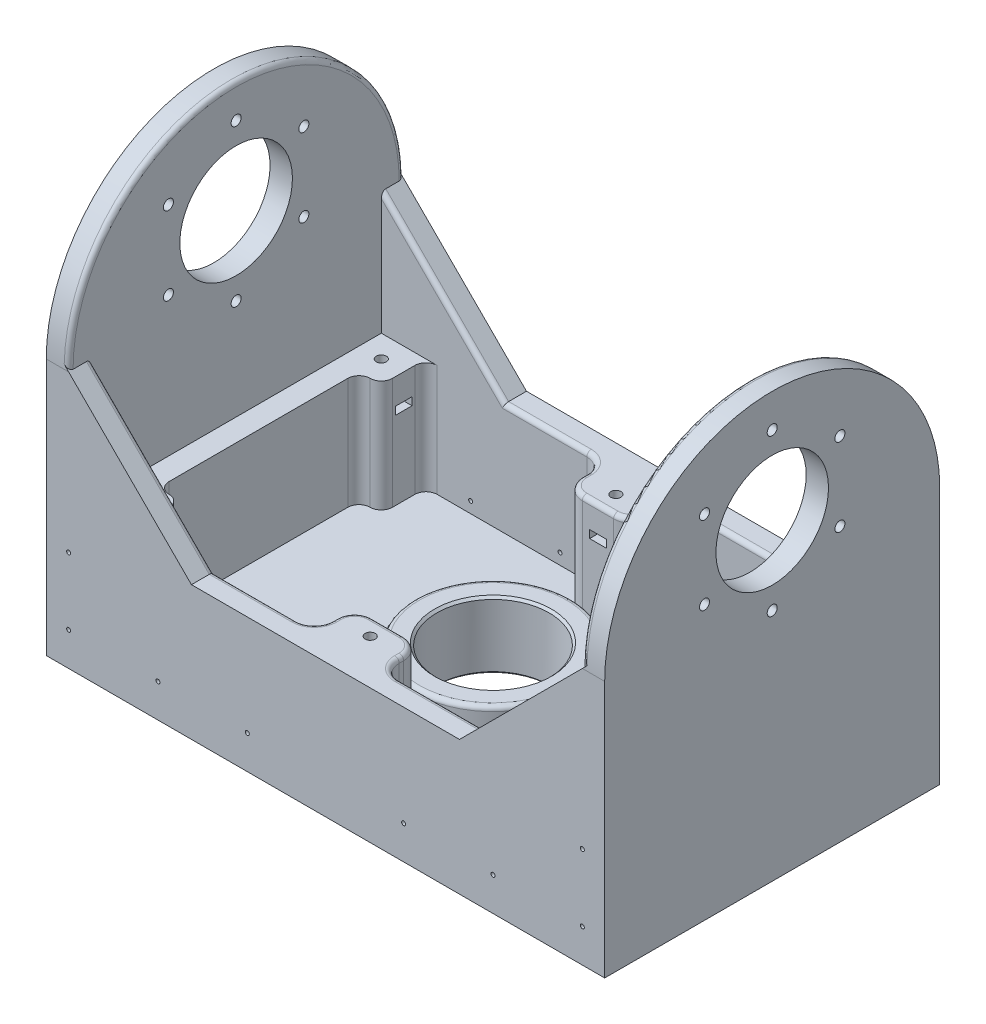
from build123d import *

# Parameters (mm, degrees)
SKETCH3_W               = 250
SKETCH3_H               = 150
BOSS_EXTRUDE1_DEPTH     = 10
SKETCH4_R               = 35
BOSS_EXTRUDE2_DEPTH     = 20
SKETCH5_R               = 25.15
CUT_EXTRUDE1_DEPTH      = 149.828760661
CHAMFER1_SIZE           = 1
FILLET1_R               = 2
FILLET2_R               = 10
BOSS_EXTRUDE3_DEPTH     = 10
SKETCH9_W               = 230
SKETCH9_H               = 150
SKETCH9_W_2             = 210
SKETCH9_H_2             = 130
BOSS_EXTRUDE4_DEPTH     = 50
BOSS_EXTRUDE5_DEPTH     = 10
SKETCH11_W              = 10
SKETCH11_H              = 20
BOSS_EXTRUDE7_DEPTH     = 50
SKETCH13_R              = 2.25
CUT_EXTRUDE2_DEPTH      = 25
CUT_EXTRUDE3_DEPTH      = 3.5
FILLET3_R               = 5
MIRROR3_COPY_1_DEPTH    = 10
MIRROR3_COPY_2_SKETCH_W = 10
MIRROR3_COPY_2_SKETCH_H = 20
MIRROR3_COPY_2_DEPTH    = 50
MIRROR3_COPY_3_SKETCH_R = 2.25
MIRROR3_COPY_3_DEPTH    = 25
MIRROR3_COPY_4_DEPTH    = 3.5
FILLET4_R               = 5
SKETCH15_W              = 30
SKETCH15_H              = 18
BOSS_EXTRUDE8_DEPTH     = 50
SKETCH17_R              = 2.25
CUT_EXTRUDE4_DEPTH      = 25
CUT_EXTRUDE5_DEPTH      = 3.5
FILLET5_R               = 8
FILLET6_R               = 8
CUT_EXTRUDE6_REACH      = 324.839
SKETCH19_R              = 25.2
CUT_EXTRUDE7_REACH      = 324.839
SKETCH20_R              = 2.25
CIRPATTERN1_COUNT       = 6
MIRROR5_COPY_1_REACH    = 324.839
MIRROR5_COPY_1_SKETCH_R = 2.25
MIRROR5_COPY_2_REACH    = 324.839
MIRROR5_COPY_2_SKETCH_R = 2.25
MIRROR5_COPY_3_REACH    = 324.839
MIRROR5_COPY_3_SKETCH_R = 2.25
MIRROR5_COPY_4_REACH    = 324.839
MIRROR5_COPY_4_SKETCH_R = 2.25
MIRROR5_COPY_5_REACH    = 324.839
MIRROR5_COPY_5_SKETCH_R = 2.25
CUT_EXTRUDE8_DEPTH      = 3.5
CIRPATTERN2_COUNT       = 6
FILLET7_R               = 2
SKETCH22_R              = 0.9
CUT_EXTRUDE10_DEPTH     = 10
MIRROR7_COPY_1_SKETCH_R = 0.9
MIRROR7_COPY_1_DEPTH    = 10


# Some blends are built 0.0001 mm under size
with BuildPart() as part:
    # Sketch3 → Boss-Extrude1 (new body)
    with BuildSketch(Plane(origin=(0, 0, 0), x_dir=(1, 0, 0), z_dir=(0, 1, 0))):
        Rectangle(SKETCH3_W, SKETCH3_H)
    extrude(amount=BOSS_EXTRUDE1_DEPTH)

    # Sketch4 → Boss-Extrude2 (add)
    with BuildSketch(Plane(origin=(0, 10, 0), x_dir=(1, 0, 0), z_dir=(0, 1, 0))):
        with Locations(Location((0, 0, 0), (0, 0, 270))):
            Circle(SKETCH4_R)
    extrude(amount=BOSS_EXTRUDE2_DEPTH)

    # Sketch5 → Cut-Extrude1 (cut, through all)
    with BuildSketch(Plane(origin=(0, 30, 0), x_dir=(1, 0, 0), z_dir=(0, 1, 0))):
        with Locations(Location((0, 0, 0), (0, 0, 270))):
            Circle(SKETCH5_R)
    extrude(amount=-CUT_EXTRUDE1_DEPTH, mode=Mode.SUBTRACT)

    # Chamfer1
    chamfer1_edges = [part.edges().sort_by_distance(p)[0] for p in [
        (0, 0, -25.15),
        (0, 30, -25.15),
    ]]
    chamfer(chamfer1_edges, length=CHAMFER1_SIZE)

    # Fillet1
    fillet1_edges = [part.edges().sort_by_distance(p)[0] for p in [
        (0, 30, -35),
    ]]
    fillet(fillet1_edges, radius=FILLET1_R)

    # Fillet2
    fillet2_edges = [part.edges().sort_by_distance(p)[0] for p in [
        (0, 10, -35),
    ]]
    fillet(fillet2_edges, radius=FILLET2_R)

    # Sketch8 → Boss-Extrude3 (add)
    with BuildSketch(Plane.ZY.offset(125)):
        with BuildLine():
            Line((-75, 10), (-75, 115))
            ThreePointArc((-75, 115), (0, 190), (75, 115))
            Line((75, 115), (75, 10))
            Line((75, 10), (-75, 10))
        make_face()
    boss_extrude3 = extrude(amount=-BOSS_EXTRUDE3_DEPTH)

    # Mirror1: Boss-Extrude3 across plane
    add(boss_extrude3.mirror(Plane(origin=(0, 0, 0), x_dir=(0, 0, 1), z_dir=(1, 0, 0))))

    # Sketch9 → Boss-Extrude4 (add)
    with BuildSketch(Plane(origin=(0, 10, 0), x_dir=(1, 0, 0), z_dir=(0, 1, 0))):
        Rectangle(SKETCH9_W, SKETCH9_H)
        Rectangle(SKETCH9_W_2, SKETCH9_H_2, mode=Mode.SUBTRACT)
    extrude(amount=BOSS_EXTRUDE4_DEPTH)

    # Sketch10 → Boss-Extrude5 (add)
    with BuildSketch(Plane.XY.offset(75)):
        Polygon((-115, 115), (-60, 60), (-115, 60), align=None)
    boss_extrude5 = extrude(amount=-BOSS_EXTRUDE5_DEPTH)

    # Sketch11 → Boss-Extrude7 (add)
    with BuildSketch(Plane(origin=(0, 10, 0), x_dir=(1, 0, 0), z_dir=(0, 1, 0))):
        with Locations((-100, -55)):
            Rectangle(SKETCH11_W, SKETCH11_H)
    boss_extrude7 = extrude(amount=BOSS_EXTRUDE7_DEPTH)

    # Sketch13 → Cut-Extrude2 (cut)
    with BuildSketch(Plane(origin=(0, 60, 0), x_dir=(1, 0, 0), z_dir=(0, 1, 0))):
        with Locations(Location((-105, -55, 0), (0, 0, 270))):
            Circle(SKETCH13_R)
    cut_extrude2 = extrude(amount=-CUT_EXTRUDE2_DEPTH, mode=Mode.SUBTRACT)

    # Sketch14 → Cut-Extrude3 (cut)
    with BuildSketch(Plane(origin=(0, 45, 0), x_dir=(1, 0, 0), z_dir=(0, 1, 0))):
        Polygon((-102.834936491, -51.25), (-95, -51.25), (-95, -58.75), (-102.834936491, -58.75), (-107.165063509, -58.75), (-109.330127019, -55), (-107.165063509, -51.25), align=None)
    cut_extrude3 = extrude(amount=CUT_EXTRUDE3_DEPTH, mode=Mode.SUBTRACT)

    # Fillet3
    fillet3_edges = [part.edges().sort_by_distance(p)[0] for p in [
        (-95, 35, 65),
        (-105, 35, 45),
        (-95, 35, 45),
    ]]
    fillet(fillet3_edges, radius=FILLET3_R - 0.0001)  # a hair under: the kernel refuses the full size

    # Mirror2: Boss-Extrude5, Boss-Extrude7, Cut-Extrude2, Cut-Extrude3 across plane
    add(boss_extrude5.mirror(Plane.XY))
    add(boss_extrude7.mirror(Plane.XY))
    add(cut_extrude2.mirror(Plane.XY), mode=Mode.SUBTRACT)
    add(cut_extrude3.mirror(Plane.XY), mode=Mode.SUBTRACT)

    # Mirror3: Boss-Extrude5, Boss-Extrude7, Cut-Extrude2, Cut-Extrude3 across plane
    add(boss_extrude5.mirror(Plane(origin=(0, 0, 0), x_dir=(0, 0, 1), z_dir=(1, 0, 0))))
    add(boss_extrude7.mirror(Plane(origin=(0, 0, 0), x_dir=(0, 0, 1), z_dir=(1, 0, 0))))
    add(cut_extrude2.mirror(Plane(origin=(0, 0, 0), x_dir=(0, 0, 1), z_dir=(1, 0, 0))), mode=Mode.SUBTRACT)
    add(cut_extrude3.mirror(Plane(origin=(0, 0, 0), x_dir=(0, 0, 1), z_dir=(1, 0, 0))), mode=Mode.SUBTRACT)

    # Mirror3 copy 1 sketch → Mirror3 copy 1 (add)
    with BuildSketch(Plane(origin=(0, 0, -75), x_dir=(-1, 0, 0), z_dir=(0, 0, -1))):
        Polygon((-115, 115), (-60, 60), (-115, 60), align=None)
    extrude(amount=-MIRROR3_COPY_1_DEPTH)

    # Mirror3 copy 2 sketch → Mirror3 copy 2 (add)
    with BuildSketch(Plane(origin=(0, 10, 0), x_dir=(-1, 0, 0), z_dir=(0, 1, 0))):
        with Locations((-100, -55)):
            Rectangle(MIRROR3_COPY_2_SKETCH_W, MIRROR3_COPY_2_SKETCH_H)
    extrude(amount=MIRROR3_COPY_2_DEPTH)

    # Mirror3 copy 3 sketch → Mirror3 copy 3 (cut)
    with BuildSketch(Plane(origin=(0, 60, 0), x_dir=(-1, 0, 0), z_dir=(0, 1, 0))):
        with Locations(Location((-105, -55, 0), (0, 0, 270))):
            Circle(MIRROR3_COPY_3_SKETCH_R)
    extrude(amount=-MIRROR3_COPY_3_DEPTH, mode=Mode.SUBTRACT)

    # Mirror3 copy 4 sketch → Mirror3 copy 4 (cut)
    with BuildSketch(Plane(origin=(0, 45, 0), x_dir=(-1, 0, 0), z_dir=(0, 1, 0))):
        Polygon((-102.834936491, -51.25), (-95, -51.25), (-95, -58.75), (-102.834936491, -58.75), (-107.165063509, -58.75), (-109.330127019, -55), (-107.165063509, -51.25), align=None)
    extrude(amount=MIRROR3_COPY_4_DEPTH, mode=Mode.SUBTRACT)

    # Fillet4
    fillet4_edges = [part.edges().sort_by_distance(p)[0] for p in [
        (-95, 35, -65),
        (-95, 35, -45),
        (-105, 35, -45),
        (105, 35, -45),
        (95, 35, -65),
        (95, 35, -45),
        (95, 35, 65),
        (95, 35, 45),
        (105, 35, 45),
    ]]
    fillet(fillet4_edges, radius=FILLET4_R - 0.0001)  # a hair under: the kernel refuses the full size

    # Sketch15 → Boss-Extrude8 (add)
    with BuildSketch(Plane(origin=(0, 10, 0), x_dir=(1, 0, 0), z_dir=(0, 1, 0))):
        with Locations((0, -56)):
            Rectangle(SKETCH15_W, SKETCH15_H)
    boss_extrude8 = extrude(amount=BOSS_EXTRUDE8_DEPTH)

    # Sketch17 → Cut-Extrude4 (cut)
    with BuildSketch(Plane(origin=(0, 60, 0), x_dir=(1, 0, 0), z_dir=(0, 1, 0))):
        with Locations(Location((0, -55, 0), (0, 0, 270))):
            Circle(SKETCH17_R)
    cut_extrude4 = extrude(amount=-CUT_EXTRUDE4_DEPTH, mode=Mode.SUBTRACT)

    # Sketch18 → Cut-Extrude5 (cut)
    with BuildSketch(Plane(origin=(0, 45, 0), x_dir=(1, 0, 0), z_dir=(0, 1, 0))):
        Polygon((-3.75, -52.834936491), (-3.75, -47), (3.75, -47), (3.75, -52.834936491), (3.75, -57.165063509), (0, -59.330127019), (-3.75, -57.165063509), align=None)
    cut_extrude5 = extrude(amount=CUT_EXTRUDE5_DEPTH, mode=Mode.SUBTRACT)

    # Fillet5
    fillet5_edges = [part.edges().sort_by_distance(p)[0] for p in [
        (-15, 35, 65),
        (15, 35, 65),
        (15, 35, 47),
        (-15, 35, 47),
    ]]
    fillet(fillet5_edges, radius=FILLET5_R)

    # Mirror4: Boss-Extrude8, Cut-Extrude4, Cut-Extrude5 across plane
    add(boss_extrude8.mirror(Plane.XY))
    add(cut_extrude4.mirror(Plane.XY), mode=Mode.SUBTRACT)
    add(cut_extrude5.mirror(Plane.XY), mode=Mode.SUBTRACT)

    # Fillet6
    fillet6_edges = [part.edges().sort_by_distance(p)[0] for p in [
        (15, 35, -47),
        (-15, 35, -47),
        (-15, 35, -65),
        (15, 35, -65),
    ]]
    fillet(fillet6_edges, radius=FILLET6_R)

    # Sketch19 → Cut-Extrude6 (cut, up to next)
    with BuildSketch(Plane(origin=(125, 0, 0), x_dir=(0, 0, -1), z_dir=(1, 0, 0)), mode=Mode.PRIVATE) as cut_extrude6_sk1:
        with Locations((0, 140)):
            Circle(SKETCH19_R)
    cut_extrude6_tool1 = extrude(cut_extrude6_sk1.sketch, amount=-CUT_EXTRUDE6_REACH, mode=Mode.PRIVATE) & part.part
    cut_extrude6 = cut_extrude6_tool1.solids().sort_by_distance((125, 140, 0))[0]
    add(cut_extrude6, mode=Mode.SUBTRACT)

    # Sketch20 → Cut-Extrude7 (cut, up to next)
    with BuildSketch(Plane(origin=(125, 0, 0), x_dir=(0, 0, -1), z_dir=(1, 0, 0)), mode=Mode.PRIVATE) as cut_extrude7_sk1:
        with Locations((0, 105)):
            Circle(SKETCH20_R)
    cut_extrude7_tool1 = extrude(cut_extrude7_sk1.sketch, amount=-CUT_EXTRUDE7_REACH, mode=Mode.PRIVATE) & part.part
    cut_extrude7 = cut_extrude7_tool1.solids().sort_by_distance((125, 105, 0))[0]
    add(cut_extrude7, mode=Mode.SUBTRACT)

    # CirPattern1: Cut-Extrude7 ×6 about axis
    cirpattern1_axis = Axis((0, 140, 0), (1, 0, 0))
    for i in range(1, CIRPATTERN1_COUNT):
        add(cut_extrude7.rotate(cirpattern1_axis, i * 360 / CIRPATTERN1_COUNT), mode=Mode.SUBTRACT)

    # Mirror5: Cut-Extrude6, Cut-Extrude7 across plane
    add(cut_extrude6.mirror(Plane(origin=(0, 0, 0), x_dir=(0, 0, 1), z_dir=(1, 0, 0))), mode=Mode.SUBTRACT)
    add(cut_extrude7.mirror(Plane(origin=(0, 0, 0), x_dir=(0, 0, 1), z_dir=(1, 0, 0))), mode=Mode.SUBTRACT)

    # Mirror5 copy 1 sketch → Mirror5 copy 1 (cut, up to next)
    with BuildSketch(Plane(origin=(-125, 70, -121.24355653), x_dir=(0, 0.8660254037844386, -0.5000000000000001), z_dir=(-1, 0, 0)), mode=Mode.PRIVATE) as mirror5_copy_1_sk1:
        with Locations((0, -105)):
            Circle(MIRROR5_COPY_1_SKETCH_R)
    mirror5_copy_1_tool1 = extrude(mirror5_copy_1_sk1.sketch, amount=-MIRROR5_COPY_1_REACH, mode=Mode.PRIVATE) & part.part
    add(mirror5_copy_1_tool1.solids().sort_by_distance((-125, 122.5, -30.310889132))[0], mode=Mode.SUBTRACT)

    # Mirror5 copy 2 sketch → Mirror5 copy 2 (cut, up to next)
    with BuildSketch(Plane(origin=(-125, 210, -121.24355653), x_dir=(0, 0.8660254037844387, 0.4999999999999998), z_dir=(-1, 0, 0)), mode=Mode.PRIVATE) as mirror5_copy_2_sk1:
        with Locations((0, -105)):
            Circle(MIRROR5_COPY_2_SKETCH_R)
    mirror5_copy_2_tool1 = extrude(mirror5_copy_2_sk1.sketch, amount=-MIRROR5_COPY_2_REACH, mode=Mode.PRIVATE) & part.part
    add(mirror5_copy_2_tool1.solids().sort_by_distance((-125, 157.5, -30.310889132))[0], mode=Mode.SUBTRACT)

    # Mirror5 copy 3 sketch → Mirror5 copy 3 (cut, up to next)
    with BuildSketch(Plane(origin=(-125, 280, 0), x_dir=(0, 0, 1), z_dir=(-1, 0, 0)), mode=Mode.PRIVATE) as mirror5_copy_3_sk1:
        with Locations((0, -105)):
            Circle(MIRROR5_COPY_3_SKETCH_R)
    mirror5_copy_3_tool1 = extrude(mirror5_copy_3_sk1.sketch, amount=-MIRROR5_COPY_3_REACH, mode=Mode.PRIVATE) & part.part
    add(mirror5_copy_3_tool1.solids().sort_by_distance((-125, 175, 0))[0], mode=Mode.SUBTRACT)

    # Mirror5 copy 4 sketch → Mirror5 copy 4 (cut, up to next)
    with BuildSketch(Plane(origin=(-125, 210, 121.24355653), x_dir=(0, -0.8660254037844384, 0.5000000000000004), z_dir=(-1, 0, 0)), mode=Mode.PRIVATE) as mirror5_copy_4_sk1:
        with Locations((0, -105)):
            Circle(MIRROR5_COPY_4_SKETCH_R)
    mirror5_copy_4_tool1 = extrude(mirror5_copy_4_sk1.sketch, amount=-MIRROR5_COPY_4_REACH, mode=Mode.PRIVATE) & part.part
    add(mirror5_copy_4_tool1.solids().sort_by_distance((-125, 157.5, 30.310889132))[0], mode=Mode.SUBTRACT)

    # Mirror5 copy 5 sketch → Mirror5 copy 5 (cut, up to next)
    with BuildSketch(Plane(origin=(-125, 70, 121.24355653), x_dir=(0, -0.8660254037844386, -0.5000000000000001), z_dir=(-1, 0, 0)), mode=Mode.PRIVATE) as mirror5_copy_5_sk1:
        with Locations((0, -105)):
            Circle(MIRROR5_COPY_5_SKETCH_R)
    mirror5_copy_5_tool1 = extrude(mirror5_copy_5_sk1.sketch, amount=-MIRROR5_COPY_5_REACH, mode=Mode.PRIVATE) & part.part
    add(mirror5_copy_5_tool1.solids().sort_by_distance((-125, 122.5, 30.310889132))[0], mode=Mode.SUBTRACT)

    # Sketch21 → Cut-Extrude8 (cut)
    with BuildSketch(Plane.ZY.offset(-115)):
        Polygon((0, 170.669872981), (3.75, 172.834936491), (3.75, 177.165063509), (0, 179.330127019), (-3.75, 177.165063509), (-3.75, 172.834936491), align=None)
    cut_extrude8 = extrude(amount=-CUT_EXTRUDE8_DEPTH, mode=Mode.SUBTRACT)

    # CirPattern2: Cut-Extrude8 ×6 about axis
    cirpattern2_axis = Axis((0, 140, 0), (1, 0, 0))
    for i in range(1, CIRPATTERN2_COUNT):
        add(cut_extrude8.rotate(cirpattern2_axis, i * 360 / CIRPATTERN2_COUNT), mode=Mode.SUBTRACT)

    # Fillet7
    # the kernel refuses this fillet: 2 mm, written as the material it takes off along each edge
    with BuildSketch(Plane(origin=(-65, 60, 65), x_dir=(0, -1, 0), z_dir=(1, 0, 0))) as fillet7_piece_1_section:
        with BuildLine():
            CenterArc((FILLET7_R, -FILLET7_R), FILLET7_R, 90, 90)
            Line((0, -FILLET7_R), (0, 0))
            Line((0, 0), (FILLET7_R, 0))
        make_face()
    fillet7_piece_1 = extrude(amount=42, mode=Mode.PRIVATE)
    fillet7_piece_1 = split(fillet7_piece_1, bisect_by=Plane(origin=(-50.414222392, 50.414222392, 65.455795296), z_dir=(0.7071067811865389, 0.7071067811865562, 0)), keep=Keep.TOP, mode=Mode.PRIVATE)
    add(fillet7_piece_1, mode=Mode.SUBTRACT)
    with BuildSketch(Plane(origin=(-118.535533906, 118.535533906, 65), x_dir=(-0.7071067811865389, -0.7071067811865562, 0), z_dir=(0.7071067811865562, -0.7071067811865389, 0))) as fillet7_piece_2_section:
        with BuildLine():
            CenterArc((FILLET7_R, -FILLET7_R), FILLET7_R, 90, 90)
            Line((0, -FILLET7_R), (0, 0))
            Line((0, 0), (FILLET7_R, 0))
        make_face()
    fillet7_piece_2 = extrude(amount=87.781745931, mode=Mode.PRIVATE)
    fillet7_piece_2 = split(fillet7_piece_2, bisect_by=Plane(origin=(-115, 87.183248895, 65.455647469), z_dir=(1, 0, 0)), keep=Keep.TOP, mode=Mode.PRIVATE)
    fillet7_piece_2 = split(fillet7_piece_2, bisect_by=Plane(origin=(-87.816751105, 60, 65.455647469), z_dir=(0, 1, 0)), keep=Keep.TOP, mode=Mode.PRIVATE)
    add(fillet7_piece_2, mode=Mode.SUBTRACT)
    with BuildSketch(Plane(origin=(-118.535533906, 118.535533906, -65), x_dir=(-0.7071067811865389, -0.7071067811865562, 0), z_dir=(0.7071067811865562, -0.7071067811865389, 0))) as fillet7_piece_3_section:
        with BuildLine():
            CenterArc((FILLET7_R, FILLET7_R), FILLET7_R, 180, 90)
            Line((0, FILLET7_R), (0, 0))
            Line((0, 0), (FILLET7_R, 0))
        make_face()
    fillet7_piece_3 = extrude(amount=87.781745931, mode=Mode.PRIVATE)
    fillet7_piece_3 = split(fillet7_piece_3, bisect_by=Plane(origin=(-115, 87.183248895, -65.455647469), z_dir=(1, 0, 0)), keep=Keep.TOP, mode=Mode.PRIVATE)
    fillet7_piece_3 = split(fillet7_piece_3, bisect_by=Plane(origin=(-87.816751105, 60, -65.455647469), z_dir=(0, 1, 0)), keep=Keep.TOP, mode=Mode.PRIVATE)
    add(fillet7_piece_3, mode=Mode.SUBTRACT)
    with BuildSketch(Plane(origin=(65, 60, -65), x_dir=(0, -1, 0), z_dir=(-1, 0, 0))) as fillet7_piece_4_section:
        with BuildLine():
            CenterArc((FILLET7_R, -FILLET7_R), FILLET7_R, 90, 90)
            Line((0, -FILLET7_R), (0, 0))
            Line((0, 0), (FILLET7_R, 0))
        make_face()
    fillet7_piece_4 = extrude(amount=42, mode=Mode.PRIVATE)
    fillet7_piece_4 = split(fillet7_piece_4, bisect_by=Plane(origin=(50.414222392, 50.414222392, -65.455795296), z_dir=(-0.7071067811865389, 0.7071067811865562, 0)), keep=Keep.TOP, mode=Mode.PRIVATE)
    add(fillet7_piece_4, mode=Mode.SUBTRACT)
    with BuildSketch(Plane(origin=(118.535533906, 118.535533906, -65), x_dir=(0.7071067811865389, -0.7071067811865562, 0), z_dir=(-0.7071067811865562, -0.7071067811865389, 0))) as fillet7_piece_5_section:
        with BuildLine():
            CenterArc((FILLET7_R, -FILLET7_R), FILLET7_R, 90, 90)
            Line((0, -FILLET7_R), (0, 0))
            Line((0, 0), (FILLET7_R, 0))
        make_face()
    fillet7_piece_5 = extrude(amount=87.781745931, mode=Mode.PRIVATE)
    fillet7_piece_5 = split(fillet7_piece_5, bisect_by=Plane(origin=(115, 87.183248895, -65.455647469), z_dir=(-1, 0, 0)), keep=Keep.TOP, mode=Mode.PRIVATE)
    fillet7_piece_5 = split(fillet7_piece_5, bisect_by=Plane(origin=(87.816751105, 60, -65.455647469), z_dir=(0, 1, 0)), keep=Keep.TOP, mode=Mode.PRIVATE)
    add(fillet7_piece_5, mode=Mode.SUBTRACT)
    with BuildSketch(Plane(origin=(118.535533906, 118.535533906, 65), x_dir=(0.7071067811865389, -0.7071067811865562, 0), z_dir=(-0.7071067811865562, -0.7071067811865389, 0))) as fillet7_piece_6_section:
        with BuildLine():
            CenterArc((FILLET7_R, FILLET7_R), FILLET7_R, 180, 90)
            Line((0, FILLET7_R), (0, 0))
            Line((0, 0), (FILLET7_R, 0))
        make_face()
    fillet7_piece_6 = extrude(amount=87.781745931, mode=Mode.PRIVATE)
    fillet7_piece_6 = split(fillet7_piece_6, bisect_by=Plane(origin=(115, 87.183248895, 65.455647469), z_dir=(-1, 0, 0)), keep=Keep.TOP, mode=Mode.PRIVATE)
    fillet7_piece_6 = split(fillet7_piece_6, bisect_by=Plane(origin=(87.816751105, 60, 65.455647469), z_dir=(0, 1, 0)), keep=Keep.TOP, mode=Mode.PRIVATE)
    add(fillet7_piece_6, mode=Mode.SUBTRACT)
    with BuildSketch(Plane(origin=(-15, 60, 57), x_dir=(0, -1, 0), z_dir=(0, 0, -1)), Plane(origin=(15, 60, 55), x_dir=(0, -1, 0), z_dir=(0, 0, 1))) as fillet7_piece_7:
        with BuildLine():
            CenterArc((FILLET7_R, -FILLET7_R), FILLET7_R, 90, 90)
            Line((0, -FILLET7_R), (0, 0))
            Line((0, 0), (FILLET7_R, 0))
        make_face()
    extrude(amount=2, mode=Mode.SUBTRACT)
    with BuildSketch(Plane(origin=(23, 60, 65), x_dir=(0, -1, 0), z_dir=(1, 0, 0))) as fillet7_piece_8_section:
        with BuildLine():
            CenterArc((FILLET7_R, -FILLET7_R), FILLET7_R, 90, 90)
            Line((0, -FILLET7_R), (0, 0))
            Line((0, 0), (FILLET7_R, 0))
        make_face()
    fillet7_piece_8 = extrude(amount=42, mode=Mode.PRIVATE)
    fillet7_piece_8 = split(fillet7_piece_8, bisect_by=Plane(origin=(50.414222392, 50.414222392, 65.455795296), z_dir=(-0.7071067811865389, 0.7071067811865562, 0)), keep=Keep.TOP, mode=Mode.PRIVATE)
    add(fillet7_piece_8, mode=Mode.SUBTRACT)
    with BuildSketch(Plane(origin=(-7, 60, 47), x_dir=(0, -1, 0), z_dir=(1, 0, 0))) as fillet7_piece_9:
        with BuildLine():
            CenterArc((FILLET7_R, -FILLET7_R), FILLET7_R, 90, 90)
            Line((0, -FILLET7_R), (0, 0))
            Line((0, 0), (FILLET7_R, 0))
        make_face()
    extrude(amount=14, mode=Mode.SUBTRACT)
    with BuildSketch(Plane(origin=(-7, 60, 55), x_dir=(0, 0, -1), z_dir=(1, 0, 0))) as fillet7_piece_10:
        with BuildLine():
            CenterArc((8 - FILLET7_R, -FILLET7_R), FILLET7_R, 0, 90)
            Line((8 - FILLET7_R, 0), (8, 0))
            Line((8, 0), (8, -FILLET7_R))
        make_face()
    revolve(axis=Axis((-7, 60, 55), (0, 1, 0)), revolution_arc=90, mode=Mode.SUBTRACT)
    with BuildSketch(Plane(origin=(7, 60, 55), x_dir=(1, 0, 0), z_dir=(0, 0, 1))) as fillet7_piece_11:
        with BuildLine():
            CenterArc((8 - FILLET7_R, -FILLET7_R), FILLET7_R, 0, 90)
            Line((8 - FILLET7_R, 0), (8, 0))
            Line((8, 0), (8, -FILLET7_R))
        make_face()
    revolve(axis=Axis((7, 60, 55), (0, 1, 0)), revolution_arc=90, mode=Mode.SUBTRACT)
    with BuildSketch(Plane(origin=(-23, 60, 57), x_dir=(1, 0, 0), z_dir=(0, 0, -1))) as fillet7_piece_12:
        with BuildLine():
            CenterArc((8 + FILLET7_R, FILLET7_R), FILLET7_R, 180, 90)
            Line((8 + FILLET7_R, 0), (8, 0))
            Line((8, 0), (8, FILLET7_R))
        make_face()
    revolve(axis=Axis((-23, 60, 57), (0, -1, 0)), revolution_arc=90, mode=Mode.SUBTRACT)
    with BuildSketch(Plane(origin=(23, 60, 57), x_dir=(0, 0, 1), z_dir=(1, 0, 0))) as fillet7_piece_13:
        with BuildLine():
            CenterArc((8 + FILLET7_R, FILLET7_R), FILLET7_R, 180, 90)
            Line((8 + FILLET7_R, 0), (8, 0))
            Line((8, 0), (8, FILLET7_R))
        make_face()
    revolve(axis=Axis((23, 60, 57), (0, -1, 0)), revolution_arc=90, mode=Mode.SUBTRACT)
    with BuildSketch(Plane(origin=(15, 60, -55), x_dir=(0, -1, 0), z_dir=(0, 0, -1)), Plane(origin=(-15, 60, -57), x_dir=(0, -1, 0), z_dir=(0, 0, 1))) as fillet7_piece_14:
        with BuildLine():
            CenterArc((FILLET7_R, FILLET7_R), FILLET7_R, 180, 90)
            Line((0, FILLET7_R), (0, 0))
            Line((0, 0), (FILLET7_R, 0))
        make_face()
    extrude(amount=2, mode=Mode.SUBTRACT)
    with BuildSketch(Plane(origin=(-7, 60, -47), x_dir=(0, -1, 0), z_dir=(1, 0, 0))) as fillet7_piece_15:
        with BuildLine():
            CenterArc((FILLET7_R, FILLET7_R), FILLET7_R, 180, 90)
            Line((0, FILLET7_R), (0, 0))
            Line((0, 0), (FILLET7_R, 0))
        make_face()
    extrude(amount=14, mode=Mode.SUBTRACT)
    with BuildSketch(Plane(origin=(-115, 115, 0), x_dir=(0, -0.06672426898391166, -0.997771452752865), z_dir=(0, -0.997771452752865, 0.06672426898391166))) as fillet7_piece_16_section:
        with BuildLine():
            CenterArc((75 - FILLET7_R, -FILLET7_R), FILLET7_R, 0, 90)
            Line((75, -FILLET7_R), (75, 0))
            Line((75, 0), (75 - FILLET7_R, 0))
        make_face()
    fillet7_piece_16 = revolve(axis=Axis((-115, 115, 0), (1, 0, 0)), revolution_arc=187.651722928, mode=Mode.PRIVATE)
    fillet7_piece_16 = split(fillet7_piece_16, bisect_by=Plane(origin=(-152.5, 152.5, 0), z_dir=(0.7071067811865389, 0.7071067811865562, 0)), keep=Keep.TOP, mode=Mode.PRIVATE)
    add(fillet7_piece_16, mode=Mode.SUBTRACT)
    with BuildSketch(Plane(origin=(-23, 60, -65), x_dir=(0, -1, 0), z_dir=(-1, 0, 0))) as fillet7_piece_17_section:
        with BuildLine():
            CenterArc((FILLET7_R, -FILLET7_R), FILLET7_R, 90, 90)
            Line((0, -FILLET7_R), (0, 0))
            Line((0, 0), (FILLET7_R, 0))
        make_face()
    fillet7_piece_17 = extrude(amount=42, mode=Mode.PRIVATE)
    fillet7_piece_17 = split(fillet7_piece_17, bisect_by=Plane(origin=(-50.414222392, 50.414222392, -65.455795296), z_dir=(0.7071067811865389, 0.7071067811865562, 0)), keep=Keep.TOP, mode=Mode.PRIVATE)
    add(fillet7_piece_17, mode=Mode.SUBTRACT)
    with BuildSketch(Plane(origin=(-7, 60, -55), x_dir=(-1, 0, 0), z_dir=(0, 0, -1))) as fillet7_piece_18:
        with BuildLine():
            CenterArc((8 - FILLET7_R, -FILLET7_R), FILLET7_R, 0, 90)
            Line((8 - FILLET7_R, 0), (8, 0))
            Line((8, 0), (8, -FILLET7_R))
        make_face()
    revolve(axis=Axis((-7, 60, -55), (0, 1, 0)), revolution_arc=90, mode=Mode.SUBTRACT)
    with BuildSketch(Plane(origin=(7, 60, -55), x_dir=(0, 0, 1), z_dir=(-1, 0, 0))) as fillet7_piece_19:
        with BuildLine():
            CenterArc((8 - FILLET7_R, -FILLET7_R), FILLET7_R, 0, 90)
            Line((8 - FILLET7_R, 0), (8, 0))
            Line((8, 0), (8, -FILLET7_R))
        make_face()
    revolve(axis=Axis((7, 60, -55), (0, 1, 0)), revolution_arc=90, mode=Mode.SUBTRACT)
    with BuildSketch(Plane(origin=(23, 60, -57), x_dir=(-1, 0, 0), z_dir=(0, 0, 1))) as fillet7_piece_20:
        with BuildLine():
            CenterArc((8 + FILLET7_R, FILLET7_R), FILLET7_R, 180, 90)
            Line((8 + FILLET7_R, 0), (8, 0))
            Line((8, 0), (8, FILLET7_R))
        make_face()
    revolve(axis=Axis((23, 60, -57), (0, -1, 0)), revolution_arc=90, mode=Mode.SUBTRACT)
    with BuildSketch(Plane(origin=(-23, 60, -57), x_dir=(0, 0, -1), z_dir=(-1, 0, 0))) as fillet7_piece_21:
        with BuildLine():
            CenterArc((8 + FILLET7_R, FILLET7_R), FILLET7_R, 180, 90)
            Line((8 + FILLET7_R, 0), (8, 0))
            Line((8, 0), (8, FILLET7_R))
        make_face()
    revolve(axis=Axis((-23, 60, -57), (0, -1, 0)), revolution_arc=90, mode=Mode.SUBTRACT)
    with BuildSketch(Plane(origin=(115, 115, 0), x_dir=(0, -0.06672426898391166, -0.997771452752865), z_dir=(0, -0.997771452752865, 0.06672426898391166))) as fillet7_piece_22_section:
        with BuildLine():
            CenterArc((75 - FILLET7_R, FILLET7_R), FILLET7_R, 270, 90)
            Line((75, FILLET7_R), (75, 0))
            Line((75, 0), (75 - FILLET7_R, 0))
        make_face()
    fillet7_piece_22 = revolve(axis=Axis((115, 115, 0), (1, 0, 0)), revolution_arc=187.651722928, mode=Mode.PRIVATE)
    fillet7_piece_22 = split(fillet7_piece_22, bisect_by=Plane(origin=(152.5, 152.5, 0), z_dir=(-0.7071067811865389, 0.7071067811865562, 0)), keep=Keep.TOP, mode=Mode.PRIVATE)
    add(fillet7_piece_22, mode=Mode.SUBTRACT)
    with BuildSketch(Plane(origin=(-65, 60, 65), x_dir=(0, -1, 0), z_dir=(1, 0, 0))) as fillet7_piece_23a_section:
        with BuildLine():
            CenterArc((FILLET7_R, -FILLET7_R), FILLET7_R, 90, 90)
            Line((0, -FILLET7_R), (0, 0))
            Line((0, 0), (FILLET7_R, 0))
        make_face()
    fillet7_piece_23a = extrude(amount=42, mode=Mode.PRIVATE)
    fillet7_piece_23a = split(fillet7_piece_23a, bisect_by=Plane(origin=(-60.88483695, 60.88483695, 65.432648826), z_dir=(-0.7071067811865389, -0.7071067811865562, 0)), keep=Keep.TOP, mode=Mode.PRIVATE)
    with BuildSketch(Plane(origin=(-118.535533906, 118.535533906, 65), x_dir=(-0.7071067811865389, -0.7071067811865562, 0), z_dir=(0.7071067811865562, -0.7071067811865389, 0))) as fillet7_piece_23b_section:
        with BuildLine():
            CenterArc((FILLET7_R, -FILLET7_R), FILLET7_R, 90, 90)
            Line((0, -FILLET7_R), (0, 0))
            Line((0, 0), (FILLET7_R, 0))
        make_face()
    fillet7_piece_23b = extrude(amount=87.781745931, mode=Mode.PRIVATE)
    fillet7_piece_23b = split(fillet7_piece_23b, bisect_by=Plane(origin=(-58.748651584, 60, 65.432648826), z_dir=(0, -1, 0)), keep=Keep.TOP, mode=Mode.PRIVATE)
    fillet7_piece_23 = fillet7_piece_23a & fillet7_piece_23b
    add(fillet7_piece_23, mode=Mode.SUBTRACT)
    with BuildSketch(Plane(origin=(-23, 60, -65), x_dir=(0, -1, 0), z_dir=(-1, 0, 0))) as fillet7_piece_24a_section:
        with BuildLine():
            CenterArc((FILLET7_R, -FILLET7_R), FILLET7_R, 90, 90)
            Line((0, -FILLET7_R), (0, 0))
            Line((0, 0), (FILLET7_R, 0))
        make_face()
    fillet7_piece_24a = extrude(amount=42, mode=Mode.PRIVATE)
    fillet7_piece_24a = split(fillet7_piece_24a, bisect_by=Plane(origin=(-60.88483695, 60.88483695, -65.432648826), z_dir=(-0.7071067811865389, -0.7071067811865562, 0)), keep=Keep.TOP, mode=Mode.PRIVATE)
    with BuildSketch(Plane(origin=(-118.535533906, 118.535533906, -65), x_dir=(-0.7071067811865389, -0.7071067811865562, 0), z_dir=(0.7071067811865562, -0.7071067811865389, 0))) as fillet7_piece_24b_section:
        with BuildLine():
            CenterArc((FILLET7_R, FILLET7_R), FILLET7_R, 180, 90)
            Line((0, FILLET7_R), (0, 0))
            Line((0, 0), (FILLET7_R, 0))
        make_face()
    fillet7_piece_24b = extrude(amount=87.781745931, mode=Mode.PRIVATE)
    fillet7_piece_24b = split(fillet7_piece_24b, bisect_by=Plane(origin=(-58.748651584, 60, -65.432648826), z_dir=(0, -1, 0)), keep=Keep.TOP, mode=Mode.PRIVATE)
    fillet7_piece_24 = fillet7_piece_24a & fillet7_piece_24b
    add(fillet7_piece_24, mode=Mode.SUBTRACT)
    with BuildSketch(Plane(origin=(65, 60, -65), x_dir=(0, -1, 0), z_dir=(-1, 0, 0))) as fillet7_piece_25a_section:
        with BuildLine():
            CenterArc((FILLET7_R, -FILLET7_R), FILLET7_R, 90, 90)
            Line((0, -FILLET7_R), (0, 0))
            Line((0, 0), (FILLET7_R, 0))
        make_face()
    fillet7_piece_25a = extrude(amount=42, mode=Mode.PRIVATE)
    fillet7_piece_25a = split(fillet7_piece_25a, bisect_by=Plane(origin=(60.88483695, 60.88483695, -65.432648826), z_dir=(0.7071067811865389, -0.7071067811865562, 0)), keep=Keep.TOP, mode=Mode.PRIVATE)
    with BuildSketch(Plane(origin=(118.535533906, 118.535533906, -65), x_dir=(0.7071067811865389, -0.7071067811865562, 0), z_dir=(-0.7071067811865562, -0.7071067811865389, 0))) as fillet7_piece_25b_section:
        with BuildLine():
            CenterArc((FILLET7_R, -FILLET7_R), FILLET7_R, 90, 90)
            Line((0, -FILLET7_R), (0, 0))
            Line((0, 0), (FILLET7_R, 0))
        make_face()
    fillet7_piece_25b = extrude(amount=87.781745931, mode=Mode.PRIVATE)
    fillet7_piece_25b = split(fillet7_piece_25b, bisect_by=Plane(origin=(58.748651584, 60, -65.432648826), z_dir=(0, -1, 0)), keep=Keep.TOP, mode=Mode.PRIVATE)
    fillet7_piece_25 = fillet7_piece_25a & fillet7_piece_25b
    add(fillet7_piece_25, mode=Mode.SUBTRACT)
    with BuildSketch(Plane(origin=(23, 60, 65), x_dir=(0, -1, 0), z_dir=(1, 0, 0))) as fillet7_piece_26a_section:
        with BuildLine():
            CenterArc((FILLET7_R, -FILLET7_R), FILLET7_R, 90, 90)
            Line((0, -FILLET7_R), (0, 0))
            Line((0, 0), (FILLET7_R, 0))
        make_face()
    fillet7_piece_26a = extrude(amount=42, mode=Mode.PRIVATE)
    fillet7_piece_26a = split(fillet7_piece_26a, bisect_by=Plane(origin=(60.88483695, 60.88483695, 65.432648826), z_dir=(0.7071067811865389, -0.7071067811865562, 0)), keep=Keep.TOP, mode=Mode.PRIVATE)
    with BuildSketch(Plane(origin=(118.535533906, 118.535533906, 65), x_dir=(0.7071067811865389, -0.7071067811865562, 0), z_dir=(-0.7071067811865562, -0.7071067811865389, 0))) as fillet7_piece_26b_section:
        with BuildLine():
            CenterArc((FILLET7_R, FILLET7_R), FILLET7_R, 180, 90)
            Line((0, FILLET7_R), (0, 0))
            Line((0, 0), (FILLET7_R, 0))
        make_face()
    fillet7_piece_26b = extrude(amount=87.781745931, mode=Mode.PRIVATE)
    fillet7_piece_26b = split(fillet7_piece_26b, bisect_by=Plane(origin=(58.748651584, 60, 65.432648826), z_dir=(0, -1, 0)), keep=Keep.TOP, mode=Mode.PRIVATE)
    fillet7_piece_26 = fillet7_piece_26a & fillet7_piece_26b
    add(fillet7_piece_26, mode=Mode.SUBTRACT)

    # Sketch22 → Cut-Extrude10 (cut)
    with BuildSketch(Plane.XY.offset(75)):
        with Locations((-115, 15)):
            Circle(SKETCH22_R)
        with Locations((-115, 45)):
            Circle(SKETCH22_R)
        with Locations((-75, 15)):
            Circle(SKETCH22_R)
        with Locations((-35, 15)):
            Circle(SKETCH22_R)
    cut_extrude10 = extrude(amount=-CUT_EXTRUDE10_DEPTH, mode=Mode.SUBTRACT)

    # Mirror6: Cut-Extrude10 across plane
    add(cut_extrude10.mirror(Plane(origin=(0, 0, 0), x_dir=(0, 0, 1), z_dir=(1, 0, 0))), mode=Mode.SUBTRACT)

    # Mirror7: Cut-Extrude10 across plane
    add(cut_extrude10.mirror(Plane.XY), mode=Mode.SUBTRACT)

    # Mirror7 copy 1 sketch → Mirror7 copy 1 (cut)
    with BuildSketch(Plane(origin=(0, 0, -75), x_dir=(-1, 0, 0), z_dir=(0, 0, -1))):
        with Locations((-115, 15)):
            Circle(MIRROR7_COPY_1_SKETCH_R)
        with Locations((-115, 45)):
            Circle(MIRROR7_COPY_1_SKETCH_R)
        with Locations((-75, 15)):
            Circle(MIRROR7_COPY_1_SKETCH_R)
        with Locations((-35, 15)):
            Circle(MIRROR7_COPY_1_SKETCH_R)
    extrude(amount=-MIRROR7_COPY_1_DEPTH, mode=Mode.SUBTRACT)


solid = part.part
